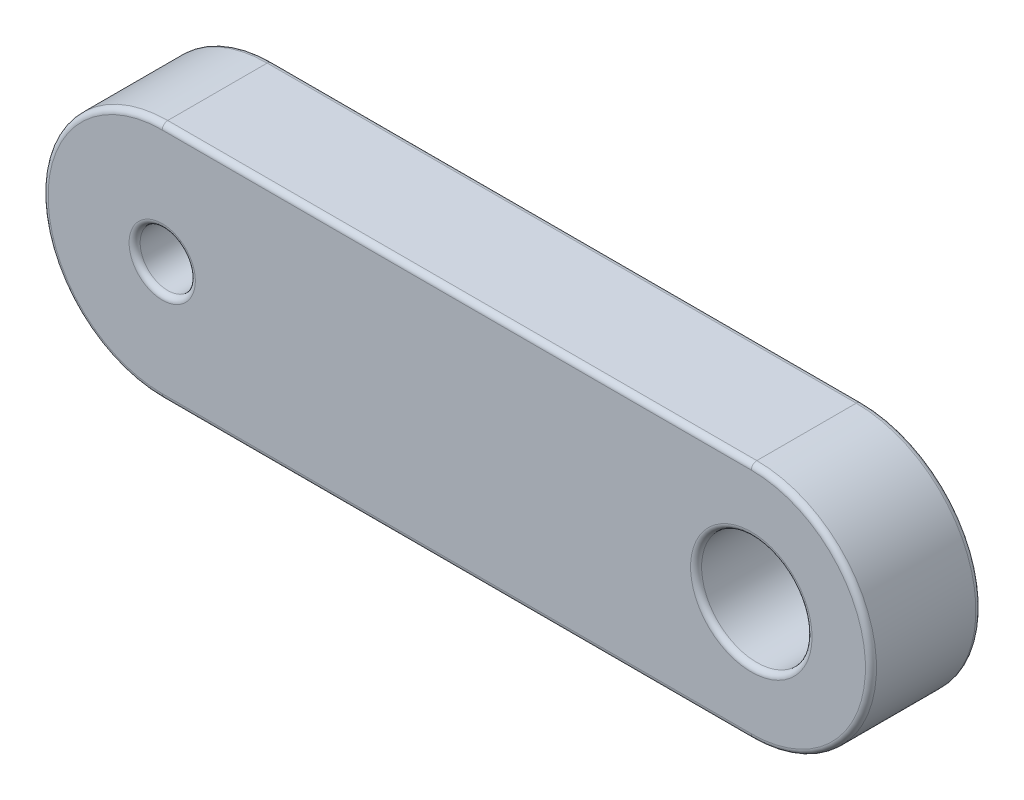
from build123d import *

# Parameters (mm, degrees)
SZKIC1_R                    = 0.75
SZKIC1_R_2                  = 1.5
DODANIE_WYCI_GNI_CIE1_DEPTH = 1.5
ZAOKR_GLENIE1_R             = 0.15


with BuildPart() as part:
    # Szkic1 → Dodanie-wyciągnięcie1 (new, symmetric)
    with BuildSketch(Plane.XY):
        with BuildLine():
            Line((-8, 3.25), (8, 3.25))
            ThreePointArc((8, 3.25), (11.25, 0), (8, -3.25))
            Line((8, -3.25), (-8, -3.25))
            ThreePointArc((-8, -3.25), (-11.25, 0), (-8, 3.25))
        make_face()
        with Locations((-8, 0)):
            Circle(SZKIC1_R, mode=Mode.SUBTRACT)
        with Locations((8, 0)):
            Circle(SZKIC1_R_2, mode=Mode.SUBTRACT)
    extrude(amount=DODANIE_WYCI_GNI_CIE1_DEPTH, both=True)

    # Zaokrąglenie1
    zaokr_glenie1_edges = [part.edges().sort_by_distance(p)[0] for p in [
        (6.5, 0, -1.5),
        (-8.75, 0, -1.5),
        (0, -3.25, -1.5),
        (11.25, 0, -1.5),
        (0, 3.25, -1.5),
        (-11.25, 0, -1.5),
        (6.5, 0, 1.5),
        (0, 3.25, 1.5),
        (11.25, 0, 1.5),
        (0, -3.25, 1.5),
        (-11.25, 0, 1.5),
        (-8.75, 0, 1.5),
    ]]
    fillet(zaokr_glenie1_edges, radius=ZAOKR_GLENIE1_R)


solid = part.part
